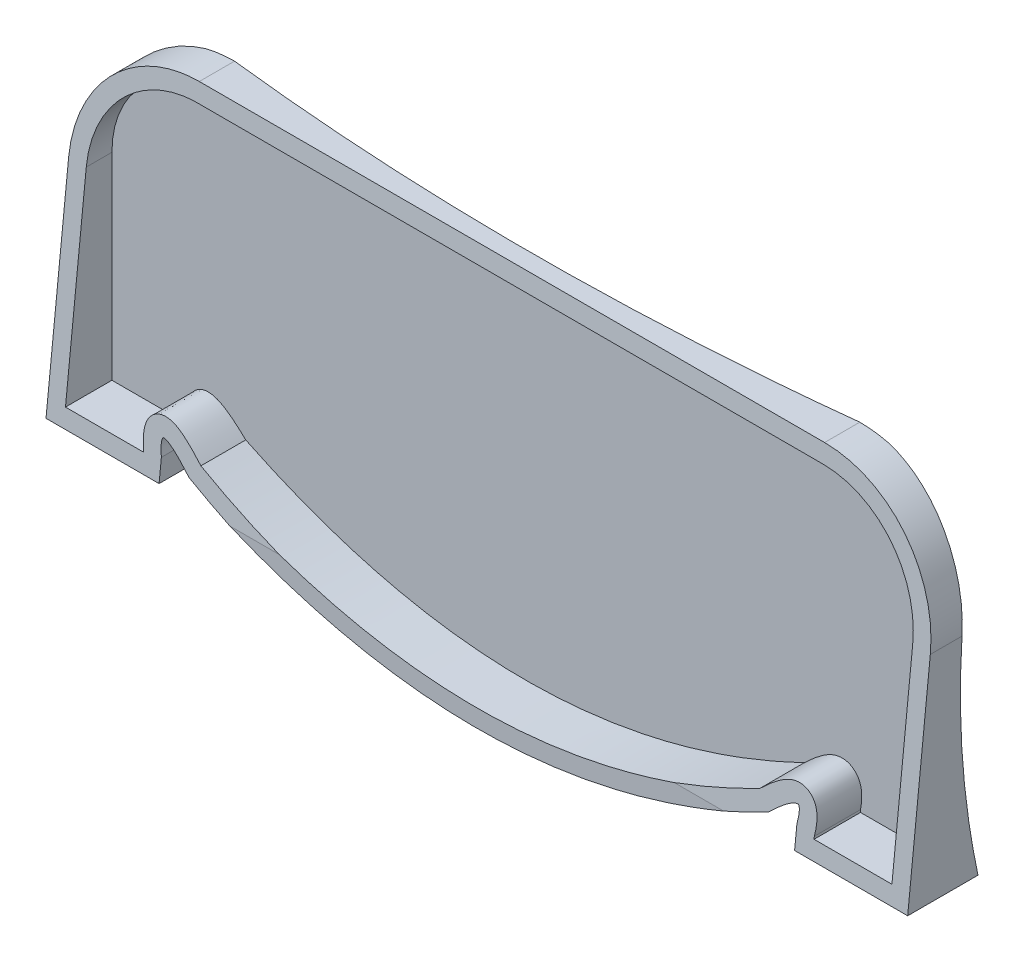
from build123d import *

# Parameters (mm, degrees)
EXTRUDE_THIN1_DEPTH     = 40
CUT_EXTRUDE1_DEPTH      = 278.4064168
CUT_EXTRUDE1_DEPTH_BACK = 278.4064168
BOSS_EXTRUDE1_DEPTH     = 12.5
CUT_EXTRUDE3_DEPTH      = 278.4064168
CUT_EXTRUDE3_DEPTH_BACK = 278.4064168
CUT_EXTRUDE4_DEPTH      = 182.5
CUT_EXTRUDE4_DEPTH_BACK = 182.5
CUT_EXTRUDE5_DEPTH      = 278.4064168
CUT_EXTRUDE5_DEPTH_BACK = 278.4064168


# Read off the part's stored shape, not the designer's step: Extrude-Thin1
with BuildPart() as part:
    # Extrude-Thin1 outline → Extrude-Thin1 (new body)
    with BuildSketch(Plane.XY):
        with BuildLine():
            Line((-244.6, 27.5), (-244.6, -94.6))
            Line((-244.6, -94.6), (-180.4, -94.6))
            Line((-180.4, -94.6), (-180.4, -82.300591097))
            add(Edge.make_bspline(
                [(-180.4, -82.300591097), (-180.515496151, -81.697922481), (-180.625382402, -81.094488913), (-180.816244908, -79.883679679), (-180.899118177, -79.276562686), (-181.028526656, -78.05737373), (-181.075519114, -77.443880009), (-181.110133354, -76.217152414), (-181.100136998, -75.604318189), (-180.994005901, -74.686834521), (-180.943606803, -74.383388997), (-180.82536159, -73.938713931), (-180.778570552, -73.791452598), (-180.660832624, -73.505725215), (-180.591882675, -73.365977993), (-180.446902027, -73.184522548), (-180.389576158, -73.128779162), (-180.251958174, -73.059996138), (-180.174521749, -73.043250366), (-179.94633476, -73.01321765), (-179.790641835, -73.02018671), (-179.334554356, -73.070965296), (-179.039728588, -73.147140563), (-178.457676187, -73.334326236), (-178.173329199, -73.446718545), (-177.618537109, -73.691211849), (-177.346944809, -73.824066281), (-176.544140075, -74.244511676), (-176.024697624, -74.553615196), (-175.004400073, -75.205795224), (-174.503079812, -75.549902912), (-173.519457539, -76.25779694), (-173.036559636, -76.622086247), (-171.607382022, -77.737599282), (-170.680280217, -78.51107571), (-168.857867658, -80.094916683), (-167.962878038, -80.905653847), (-166.195581009, -82.553447029), (-165.32478205, -83.392253346), (-164.459537211, -84.237504277)],
                knots=[0, 0, 0, 0, 0.0625, 0.0625, 0.125, 0.125, 0.1875, 0.1875, 0.25, 0.25, 0.28125, 0.28125, 0.296875, 0.296875, 0.3125, 0.3125, 0.3203125, 0.3203125, 0.328125, 0.328125, 0.34375, 0.34375, 0.375, 0.375, 0.40625, 0.40625, 0.4375, 0.4375, 0.5, 0.5, 0.5625, 0.5625, 0.625, 0.625, 0.75, 0.75, 0.875, 0.875, 1, 1, 1, 1], degree=3))
            add(Edge.make_bspline(
                [(-164.459537211, -84.237504277), (-162.851680287, -85.025510284), (-161.241088109, -85.806045371), (-158.011800446, -87.344982626), (-153.156938905, -89.623534791), (-148.268845004, -91.811317941), (-138.447116175, -96.06249602), (-131.838596572, -98.7308211), (-111.820370672, -106.209556197), (-98.218414993, -110.494866982), (-82.590974409, -114.427498013), (-80.848846017, -114.852377043), (-77.362739397, -115.675313542), (-72.130793081, -116.86956368), (-66.890461373, -117.942971907), (-56.398546642, -119.927645645), (-49.388935383, -121.034575726), (-28.314519894, -123.698487822), (-14.204139476, -124.598671335), (7.054990537, -124.600662128), (14.156961794, -124.376592112), (24.83362377, -123.698873008), (28.396462034, -123.416029656), (33.746685815, -122.905783044), (35.531963185, -122.721249999), (39.092340126, -122.324873806), (40.868836891, -122.112912393), (56.824490477, -120.08282225), (70.774212154, -117.408698297), (98.249862266, -110.479328238), (111.775745028, -106.223911732), (131.773852974, -98.756159433), (138.39139291, -96.085975692), (148.248002457, -91.820656339), (151.5157529, -90.358194843), (156.389714196, -88.106287283), (158.009860916, -87.345902656), (161.241287576, -85.805954482), (162.852071683, -85.025318448), (164.459537204, -84.237504283)],
                knots=[0, 0, 0, 0, 0.015625, 0.015625, 0.03125, 0.0625, 0.0625, 0.125, 0.125, 0.25, 0.25, 0.265625, 0.265625, 0.28125, 0.3125, 0.3125, 0.375, 0.375, 0.5, 0.5, 0.5625, 0.5625, 0.59375, 0.59375, 0.609375, 0.609375, 0.625, 0.625, 0.75, 0.75, 0.875, 0.875, 0.9375, 0.9375, 0.96875, 0.96875, 0.984375, 0.984375, 1, 1, 1, 1], degree=3))
            add(Edge.make_bspline(
                [(164.459537204, -84.237504283), (165.328063989, -83.389047246), (166.20225468, -82.547036518), (167.976833978, -80.89283191), (168.875688648, -80.0788922), (170.706574938, -78.488772736), (171.638267802, -77.712207431), (173.554463508, -76.219181879), (174.539250246, -75.500336752), (176.069961204, -74.526169315), (176.589787701, -74.218449487), (177.394168247, -73.800559036), (177.666454442, -73.668636934), (178.22324629, -73.4264584), (178.507532731, -73.315813293), (179.097059641, -73.131675553), (179.402245583, -73.05626151), (179.865114658, -73.016878123), (180.022301661, -73.014091215), (180.25098961, -73.062129151), (180.326150799, -73.08908024), (180.449248882, -73.183604525), (180.498843969, -73.245266537), (180.629182616, -73.436150598), (180.693839049, -73.577548964), (180.803226279, -73.865354519), (180.846693287, -74.011829479), (180.957202139, -74.455811951), (181.004427214, -74.758044845), (181.102910188, -75.673511075), (181.110061073, -76.280445905), (181.072302399, -77.491311425), (181.025130618, -78.095111573), (180.895914497, -79.300699555), (180.813483526, -79.902491207), (180.623591526, -81.104524933), (180.514515495, -81.703039629), (180.4, -82.300591097)],
                knots=[0, 0, 0, 0, 0.125, 0.125, 0.25, 0.25, 0.375, 0.375, 0.5, 0.5, 0.5625, 0.5625, 0.59375, 0.59375, 0.625, 0.625, 0.65625, 0.65625, 0.671875, 0.671875, 0.6796875, 0.6796875, 0.6875, 0.6875, 0.703125, 0.703125, 0.71875, 0.71875, 0.75, 0.75, 0.8125, 0.8125, 0.875, 0.875, 0.9375, 0.9375, 1, 1, 1, 1], degree=3))
            Line((180.4, -82.300591097), (180.4, -94.6))
            Line((180.4, -94.6), (244.6, -94.6))
            Line((244.6, -94.6), (244.6, 27.5))
            ThreePointArc((244.6, 27.5), (224.946865018, 74.946865018), (177.5, 94.6))
            Line((177.5, 94.6), (-177.5, 94.6))
            ThreePointArc((-177.5, 94.6), (-224.946865018, 74.946865018), (-244.6, 27.5))
        make_face()
        with BuildLine():
            Line((-190.4, -84.6), (-234.6, -84.6))
            Line((-234.6, -84.6), (-234.6, 27.5))
            ThreePointArc((-234.6, 27.5), (-217.875797206, 67.875797206), (-177.5, 84.6))
            Line((-177.5, 84.6), (177.5, 84.6))
            ThreePointArc((177.5, 84.6), (217.875797206, 67.875797206), (234.6, 27.5))
            Line((234.6, 27.5), (234.6, -84.6))
            Line((234.6, -84.6), (190.4, -84.6))
            Line((190.4, -84.6), (190.4, -83.225587869))
            add(Edge.make_bspline(
                [(158.636956076, -75.952815577), (160.193036278, -74.456410246), (161.7760024, -72.993636298), (164.217463956, -70.883300612), (165.042619642, -70.194034455), (166.723974926, -68.854334719), (167.58005592, -68.20375278), (169.336970764, -66.958569891), (170.237555253, -66.363657015), (171.640260068, -65.536119035), (172.117104902, -65.271063661), (173.081499367, -64.774521325), (173.570209137, -64.542305759), (174.563532361, -64.117082566), (175.068142134, -63.924065868), (176.096763147, -63.585863627), (176.622488611, -63.440290565), (178.223897471, -63.093644586), (179.300290552, -62.986526405), (180.931039974, -63.053849368), (181.478961589, -63.115527695), (182.542870087, -63.316319909), (183.063471423, -63.455273389), (184.081419608, -63.812158494), (184.580769688, -64.031124162), (185.545925251, -64.549502798), (186.001988116, -64.84328047), (186.863262411, -65.497170831), (187.268461429, -65.857299712), (187.83762059, -66.447897568), (188.020568359, -66.653026178), (188.367674758, -67.073018302), (188.532651181, -67.288701526), (189.002847663, -67.95215123), (189.283392937, -68.416279278), (189.657345419, -69.143547283), (189.774524367, -69.392059016), (189.991014947, -69.893228189), (190.090540796, -70.146135734), (190.547836099, -71.421418876), (190.785336039, -72.475835633), (190.998649248, -74.095540725), (191.045383134, -74.639861063), (191.098443231, -75.721323749), (191.105092435, -76.260829111), (191.077635488, -77.876421929), (190.996808677, -78.949628288), (190.753668622, -81.091016029), (190.591005772, -82.159175853), (190.4, -83.225587869)],
                knots=[0, 0, 0, 0, 0.125, 0.125, 0.1875, 0.1875, 0.25, 0.25, 0.3125, 0.3125, 0.34375, 0.34375, 0.375, 0.375, 0.40625, 0.40625, 0.4375, 0.4375, 0.5, 0.5, 0.53125, 0.53125, 0.5625, 0.5625, 0.59375, 0.59375, 0.625, 0.625, 0.65625, 0.65625, 0.671875, 0.671875, 0.6875, 0.6875, 0.71875, 0.71875, 0.734375, 0.734375, 0.75, 0.75, 0.8125, 0.8125, 0.84375, 0.84375, 0.875, 0.875, 0.9375, 0.9375, 1, 1, 1, 1], degree=3))
            add(Edge.make_bspline(
                [(-158.636956049, -75.952815602), (-146.218440652, -81.996627966), (-133.584917858, -87.439564763), (-107.837646603, -96.983364202), (-94.723984416, -101.084467951), (-79.666987259, -104.848273319), (-77.989755866, -105.254647669), (-74.626697523, -106.04337459), (-72.940599775, -106.425764442), (-67.88359157, -107.533315832), (-57.76065335, -109.593336049), (-47.610796127, -111.185439036), (-27.274780399, -113.738641189), (-13.669033874, -114.599420156), (6.813816066, -114.600289483), (13.653804185, -114.38553323), (23.932544448, -113.737338077), (29.076604074, -113.331725791), (34.227735357, -112.803191035), (37.663398499, -112.423446443), (39.380647928, -112.220008743), (54.791787753, -110.272771353), (68.258363221, -107.707159459), (94.771317802, -101.065475384), (107.817656076, -96.989256403), (127.100359221, -89.843965975), (133.480080399, -87.290210776), (142.981062556, -83.212986154), (146.137818374, -81.812201763), (152.413034279, -78.937723308), (155.533355542, -77.463268176), (158.636956076, -75.952815577)],
                knots=[0, 0, 0, 0, 0.125, 0.125, 0.25, 0.25, 0.265625, 0.265625, 0.28125, 0.28125, 0.3125, 0.375, 0.375, 0.5, 0.5, 0.5625, 0.5625, 0.59375, 0.609375, 0.609375, 0.625, 0.625, 0.75, 0.75, 0.875, 0.875, 0.9375, 0.9375, 0.96875, 0.96875, 1, 1, 1, 1], degree=3))
            add(Edge.make_bspline(
                [(-190.4, -83.225587869), (-190.591525258, -82.156275491), (-190.754778408, -81.084121928), (-190.998536297, -78.931499066), (-191.079443376, -77.851070198), (-191.105050232, -76.220804196), (-191.097285774, -75.67584996), (-191.041981627, -74.594334791), (-190.994489944, -74.056420416), (-190.851657507, -72.987448907), (-190.75633058, -72.45638979), (-190.570203107, -71.665983082), (-190.500958411, -71.403546326), (-190.346651997, -70.880939547), (-190.261359604, -70.620280633), (-189.797991191, -69.340057874), (-189.307258804, -68.37694141), (-188.514460507, -67.264295758), (-188.347038479, -67.046843861), (-187.999539873, -66.628941006), (-187.818803548, -66.427529314), (-187.255690883, -65.845851526), (-186.85250593, -65.488040122), (-185.988816156, -64.834271508), (-185.523853509, -64.536410337), (-184.565269797, -64.024086666), (-184.069864116, -63.807331922), (-183.303229401, -63.539734183), (-183.04374975, -63.460157539), (-182.516875063, -63.32036168), (-182.248549978, -63.260028563), (-181.44383732, -63.110521975), (-180.904817757, -63.051672211), (-179.822088823, -63.009212298), (-179.277055794, -63.02580035), (-178.188100262, -63.12977313), (-177.652745292, -63.216096107), (-176.069879333, -63.562381776), (-175.045475365, -63.909315208), (-173.041071464, -64.770310989), (-172.086407524, -65.272406482), (-170.236787112, -66.364620226), (-169.341942253, -66.955325716), (-167.591597888, -68.195295951), (-166.736277983, -68.844828004), (-165.053374292, -70.185172878), (-164.225261336, -70.876668019), (-161.776462789, -72.993024883), (-160.192316127, -74.457102779), (-158.636956049, -75.952815602)],
                knots=[0, 0, 0, 0, 0.0625, 0.0625, 0.125, 0.125, 0.15625, 0.15625, 0.1875, 0.1875, 0.21875, 0.21875, 0.234375, 0.234375, 0.25, 0.25, 0.3125, 0.3125, 0.328125, 0.328125, 0.34375, 0.34375, 0.375, 0.375, 0.40625, 0.40625, 0.4375, 0.4375, 0.453125, 0.453125, 0.46875, 0.46875, 0.5, 0.5, 0.53125, 0.53125, 0.5625, 0.5625, 0.625, 0.625, 0.6875, 0.6875, 0.75, 0.75, 0.8125, 0.8125, 0.875, 0.875, 1, 1, 1, 1], degree=3))
            Line((-190.4, -83.225587869), (-190.4, -84.6))
        make_face(mode=Mode.SUBTRACT)
    extrude(amount=EXTRUDE_THIN1_DEPTH)

    # Sketch4 → Cut-Extrude1 (cut, two sides: drawn at the far end of the back side and taken through both)
    with BuildSketch(Plane(origin=(0, 0, 0), x_dir=(0, 0, -1), z_dir=(1, 0, 0)).offset(-CUT_EXTRUDE1_DEPTH_BACK)):
        Polygon((-40, -95.276407788), (-40, 94.6), (-20, 94.6), align=None)
    extrude(amount=CUT_EXTRUDE1_DEPTH + CUT_EXTRUDE1_DEPTH_BACK, mode=Mode.SUBTRACT)

    # Sketch7 → Boss-Extrude1 (add)
    with BuildSketch(Plane.XY):
        with BuildLine():
            Line((-234.6, -84.6), (-190.4, -84.6))
            Line((-190.4, -84.6), (-190.4, -83.225587869))
            add(Edge.make_bspline(
                [(-190.4, -83.225587869), (-181.942162619, -61.839310916), (-158.636956049, -75.952815602)],
                knots=[0, 0, 0, 1, 1, 1], degree=2))
            add(Edge.make_bspline(
                [(-158.636956049, -75.952815602), (-104.225968138, -102.619482718), (7.86e-07, -142.38051738), (104.225967267, -102.619482521), (158.636956076, -75.952815577)],
                knots=[0.052786401, 0.052786401, 0.052786401, 0.052786401, 0.5, 0.947213601, 0.947213601, 0.947213601, 0.947213601], degree=3))
            add(Edge.make_bspline(
                [(190.4, -82.5), (181.332977445, -62.127569575), (158.636956076, -75.952815577)],
                knots=[0, 0, 0, 1, 1, 1], degree=2))
            Line((190.4, -82.5), (190.4, -84.6))
            Line((190.4, -84.6), (242.5, -84.6))
            Line((242.5, -84.6), (242.5, 27.5))
            ThreePointArc((242.5, 27.5), (223.461940777, 73.461940777), (177.5, 92.5))
            Line((177.5, 92.5), (-169.6, 92.5))
            ThreePointArc((-169.6, 92.5), (-215.561940777, 73.461940777), (-234.6, 27.5))
            Line((-234.6, 27.5), (-234.6, -84.6))
        make_face()
    extrude(amount=BOSS_EXTRUDE1_DEPTH)

    # Sketch8 → Cut-Extrude3 (cut, two sides: drawn at the far end of the back side and taken through both)
    with BuildSketch(Plane(origin=(0, 0, 0), x_dir=(0, 0, -1), z_dir=(1, 0, 0)).offset(-CUT_EXTRUDE3_DEPTH_BACK)):
        with BuildLine():
            Line((0, 92.5), (0, -94.6))
            add(Edge.make_bspline(
                [(0, 92.5), (-20.002463228, -1.026269638), (0, -94.6)],
                knots=[0, 0, 0, 1, 1, 1], degree=2))
        make_face()
    extrude(amount=CUT_EXTRUDE3_DEPTH + CUT_EXTRUDE3_DEPTH_BACK, mode=Mode.SUBTRACT)

    # Sketch9 → Cut-Extrude4 (cut, two sides: drawn at the far end of the back side and taken through both)
    with BuildSketch(Plane(origin=(0, 0, 0), x_dir=(0, 0, -1), z_dir=(1, 0, 0)).offset(-CUT_EXTRUDE4_DEPTH_BACK)):
        with BuildLine():
            Line((0, 0), (0, -124.6))
            add(Edge.make_bspline(
                [(0, 0), (-12.105717017, -62.254899565), (0, -124.6)],
                knots=[0, 0, 0, 1, 1, 1], degree=2))
        make_face()
    extrude(amount=CUT_EXTRUDE4_DEPTH + CUT_EXTRUDE4_DEPTH_BACK, mode=Mode.SUBTRACT)

    # Sketch10 → Cut-Extrude5 (cut, two sides: drawn at the far end of the back side and taken through both)
    with BuildSketch(Plane(origin=(0, 0, 0), x_dir=(1, 0, 0), z_dir=(0, 1, 0)).offset(-CUT_EXTRUDE5_DEPTH_BACK)):
        with BuildLine():
            Line((-177.5, 0), (177.5, 0))
            add(Edge.make_bspline(
                [(-177.5, 0), (0, -20), (177.5, 0)],
                knots=[0, 0, 0, 1, 1, 1], degree=2))
        make_face()
    extrude(amount=CUT_EXTRUDE5_DEPTH + CUT_EXTRUDE5_DEPTH_BACK, mode=Mode.SUBTRACT)


solid = part.part
